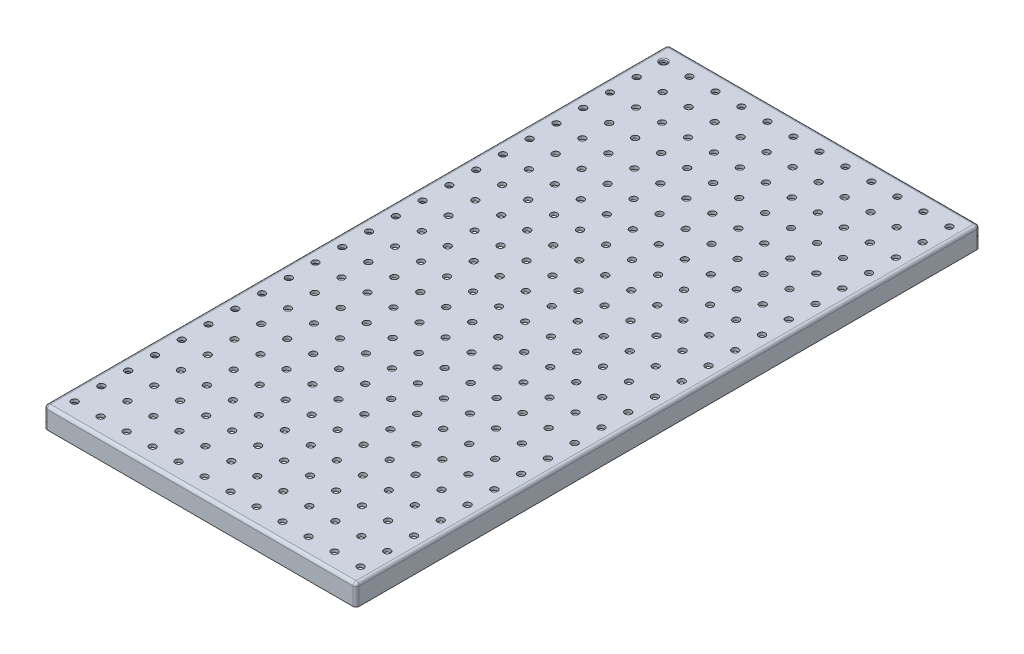
from build123d import *

# Parameters (mm, degrees)
CROQUIS1_W              = 300
CROQUIS1_H              = 600
SALIENTE_EXTRUIR1_DEPTH = 20
VACIADO1_T              = -3
CROQUIS4_R              = 3.175
CORTAR_EXTRUIR1_DEPTH   = 10
REDONDEO1_R             = 3
REDONDEO2_R             = 3
REDONDEO3_R             = 1


with BuildPart() as part:
    # Croquis1 → Saliente-Extruir1 (new body)
    with BuildSketch(Plane(origin=(0, 0, 0), x_dir=(1, 0, 0), z_dir=(0, 1, 0))):
        Rectangle(CROQUIS1_W, CROQUIS1_H)
    extrude(amount=SALIENTE_EXTRUIR1_DEPTH)

    # Vaciado1
    vaciado1_openings = [part.faces().sort_by_distance(p)[0] for p in [
        (0, 0, 0),
    ]]
    offset(amount=VACIADO1_T, openings=vaciado1_openings, kind=Kind.INTERSECTION)

    # Croquis4 → Cortar-Extruir1 (cut)
    with BuildSketch(Plane(origin=(0, 20, 0), x_dir=(1, 0, 0), z_dir=(0, 1, 0))):
        with Locations((-137.5, 283.194458678)):
            Circle(CROQUIS4_R)
        with Locations((-112.5, 283.194458678)):
            Circle(CROQUIS4_R)
        with Locations((-87.5, 283.194458678)):
            Circle(CROQUIS4_R)
        with Locations((-62.5, 283.194458678)):
            Circle(CROQUIS4_R)
        with Locations((-37.5, 283.194458678)):
            Circle(CROQUIS4_R)
        with Locations((-12.5, 283.194458678)):
            Circle(CROQUIS4_R)
        with Locations((12.5, 283.194458678)):
            Circle(CROQUIS4_R)
        with Locations((37.5, 283.194458678)):
            Circle(CROQUIS4_R)
        with Locations((62.5, 283.194458678)):
            Circle(CROQUIS4_R)
        with Locations((87.5, 283.194458678)):
            Circle(CROQUIS4_R)
        with Locations((112.5, 283.194458678)):
            Circle(CROQUIS4_R)
        with Locations((137.5, 283.194458678)):
            Circle(CROQUIS4_R)
        with Locations((-137.5, 257.449507889)):
            Circle(CROQUIS4_R)
        with Locations((-112.5, 257.449507889)):
            Circle(CROQUIS4_R)
        with Locations((-87.5, 257.449507889)):
            Circle(CROQUIS4_R)
        with Locations((-62.5, 257.449507889)):
            Circle(CROQUIS4_R)
        with Locations((-37.5, 257.449507889)):
            Circle(CROQUIS4_R)
        with Locations((-12.5, 257.449507889)):
            Circle(CROQUIS4_R)
        with Locations((12.5, 257.449507889)):
            Circle(CROQUIS4_R)
        with Locations((37.5, 257.449507889)):
            Circle(CROQUIS4_R)
        with Locations((62.5, 257.449507889)):
            Circle(CROQUIS4_R)
        with Locations((87.5, 257.449507889)):
            Circle(CROQUIS4_R)
        with Locations((112.5, 257.449507889)):
            Circle(CROQUIS4_R)
        with Locations((137.5, 257.449507889)):
            Circle(CROQUIS4_R)
        with Locations((-137.5, 231.7045571)):
            Circle(CROQUIS4_R)
        with Locations((-112.5, 231.7045571)):
            Circle(CROQUIS4_R)
        with Locations((-87.5, 231.7045571)):
            Circle(CROQUIS4_R)
        with Locations((-62.5, 231.7045571)):
            Circle(CROQUIS4_R)
        with Locations((-37.5, 231.7045571)):
            Circle(CROQUIS4_R)
        with Locations((-12.5, 231.7045571)):
            Circle(CROQUIS4_R)
        with Locations((12.5, 231.7045571)):
            Circle(CROQUIS4_R)
        with Locations((37.5, 231.7045571)):
            Circle(CROQUIS4_R)
        with Locations((62.5, 231.7045571)):
            Circle(CROQUIS4_R)
        with Locations((87.5, 231.7045571)):
            Circle(CROQUIS4_R)
        with Locations((112.5, 231.7045571)):
            Circle(CROQUIS4_R)
        with Locations((137.5, 231.7045571)):
            Circle(CROQUIS4_R)
        with Locations((-137.5, 205.959606311)):
            Circle(CROQUIS4_R)
        with Locations((-112.5, 205.959606311)):
            Circle(CROQUIS4_R)
        with Locations((-87.5, 205.959606311)):
            Circle(CROQUIS4_R)
        with Locations((-62.5, 205.959606311)):
            Circle(CROQUIS4_R)
        with Locations((-37.5, 205.959606311)):
            Circle(CROQUIS4_R)
        with Locations((-12.5, 205.959606311)):
            Circle(CROQUIS4_R)
        with Locations((12.5, 205.959606311)):
            Circle(CROQUIS4_R)
        with Locations((37.5, 205.959606311)):
            Circle(CROQUIS4_R)
        with Locations((62.5, 205.959606311)):
            Circle(CROQUIS4_R)
        with Locations((87.5, 205.959606311)):
            Circle(CROQUIS4_R)
        with Locations((112.5, 205.959606311)):
            Circle(CROQUIS4_R)
        with Locations((137.5, 205.959606311)):
            Circle(CROQUIS4_R)
        with Locations((-137.5, 180.214655522)):
            Circle(CROQUIS4_R)
        with Locations((-112.5, 180.214655522)):
            Circle(CROQUIS4_R)
        with Locations((-87.5, 180.214655522)):
            Circle(CROQUIS4_R)
        with Locations((-62.5, 180.214655522)):
            Circle(CROQUIS4_R)
        with Locations((-37.5, 180.214655522)):
            Circle(CROQUIS4_R)
        with Locations((-12.5, 180.214655522)):
            Circle(CROQUIS4_R)
        with Locations((12.5, 180.214655522)):
            Circle(CROQUIS4_R)
        with Locations((37.5, 180.214655522)):
            Circle(CROQUIS4_R)
        with Locations((62.5, 180.214655522)):
            Circle(CROQUIS4_R)
        with Locations((87.5, 180.214655522)):
            Circle(CROQUIS4_R)
        with Locations((112.5, 180.214655522)):
            Circle(CROQUIS4_R)
        with Locations((137.5, 180.214655522)):
            Circle(CROQUIS4_R)
        with Locations((-137.5, 154.469704733)):
            Circle(CROQUIS4_R)
        with Locations((-112.5, 154.469704733)):
            Circle(CROQUIS4_R)
        with Locations((-87.5, 154.469704733)):
            Circle(CROQUIS4_R)
        with Locations((-62.5, 154.469704733)):
            Circle(CROQUIS4_R)
        with Locations((-37.5, 154.469704733)):
            Circle(CROQUIS4_R)
        with Locations((-12.5, 154.469704733)):
            Circle(CROQUIS4_R)
        with Locations((12.5, 154.469704733)):
            Circle(CROQUIS4_R)
        with Locations((37.5, 154.469704733)):
            Circle(CROQUIS4_R)
        with Locations((62.5, 154.469704733)):
            Circle(CROQUIS4_R)
        with Locations((87.5, 154.469704733)):
            Circle(CROQUIS4_R)
        with Locations((112.5, 154.469704733)):
            Circle(CROQUIS4_R)
        with Locations((137.5, 154.469704733)):
            Circle(CROQUIS4_R)
        with Locations((-137.5, 128.724753944)):
            Circle(CROQUIS4_R)
        with Locations((-112.5, 128.724753944)):
            Circle(CROQUIS4_R)
        with Locations((-87.5, 128.724753944)):
            Circle(CROQUIS4_R)
        with Locations((-62.5, 128.724753944)):
            Circle(CROQUIS4_R)
        with Locations((-37.5, 128.724753944)):
            Circle(CROQUIS4_R)
        with Locations((-12.5, 128.724753944)):
            Circle(CROQUIS4_R)
        with Locations((12.5, 128.724753944)):
            Circle(CROQUIS4_R)
        with Locations((37.5, 128.724753944)):
            Circle(CROQUIS4_R)
        with Locations((62.5, 128.724753944)):
            Circle(CROQUIS4_R)
        with Locations((87.5, 128.724753944)):
            Circle(CROQUIS4_R)
        with Locations((112.5, 128.724753944)):
            Circle(CROQUIS4_R)
        with Locations((137.5, 128.724753944)):
            Circle(CROQUIS4_R)
        with Locations((-137.5, 102.979803155)):
            Circle(CROQUIS4_R)
        with Locations((-112.5, 102.979803155)):
            Circle(CROQUIS4_R)
        with Locations((-87.5, 102.979803155)):
            Circle(CROQUIS4_R)
        with Locations((-62.5, 102.979803155)):
            Circle(CROQUIS4_R)
        with Locations((-37.5, 102.979803155)):
            Circle(CROQUIS4_R)
        with Locations((-12.5, 102.979803155)):
            Circle(CROQUIS4_R)
        with Locations((12.5, 102.979803155)):
            Circle(CROQUIS4_R)
        with Locations((37.5, 102.979803155)):
            Circle(CROQUIS4_R)
        with Locations((62.5, 102.979803155)):
            Circle(CROQUIS4_R)
        with Locations((87.5, 102.979803155)):
            Circle(CROQUIS4_R)
        with Locations((112.5, 102.979803155)):
            Circle(CROQUIS4_R)
        with Locations((137.5, 102.979803155)):
            Circle(CROQUIS4_R)
        with Locations((-137.5, 77.234852367)):
            Circle(CROQUIS4_R)
        with Locations((-112.5, 77.234852367)):
            Circle(CROQUIS4_R)
        with Locations((-87.5, 77.234852367)):
            Circle(CROQUIS4_R)
        with Locations((-62.5, 77.234852367)):
            Circle(CROQUIS4_R)
        with Locations((-37.5, 77.234852367)):
            Circle(CROQUIS4_R)
        with Locations((-12.5, 77.234852367)):
            Circle(CROQUIS4_R)
        with Locations((12.5, 77.234852367)):
            Circle(CROQUIS4_R)
        with Locations((37.5, 77.234852367)):
            Circle(CROQUIS4_R)
        with Locations((62.5, 77.234852367)):
            Circle(CROQUIS4_R)
        with Locations((87.5, 77.234852367)):
            Circle(CROQUIS4_R)
        with Locations((112.5, 77.234852367)):
            Circle(CROQUIS4_R)
        with Locations((137.5, 77.234852367)):
            Circle(CROQUIS4_R)
        with Locations((-137.5, 51.489901578)):
            Circle(CROQUIS4_R)
        with Locations((-112.5, 51.489901578)):
            Circle(CROQUIS4_R)
        with Locations((-87.5, 51.489901578)):
            Circle(CROQUIS4_R)
        with Locations((-62.5, 51.489901578)):
            Circle(CROQUIS4_R)
        with Locations((-37.5, 51.489901578)):
            Circle(CROQUIS4_R)
        with Locations((-12.5, 51.489901578)):
            Circle(CROQUIS4_R)
        with Locations((12.5, 51.489901578)):
            Circle(CROQUIS4_R)
        with Locations((37.5, 51.489901578)):
            Circle(CROQUIS4_R)
        with Locations((62.5, 51.489901578)):
            Circle(CROQUIS4_R)
        with Locations((87.5, 51.489901578)):
            Circle(CROQUIS4_R)
        with Locations((112.5, 51.489901578)):
            Circle(CROQUIS4_R)
        with Locations((137.5, 51.489901578)):
            Circle(CROQUIS4_R)
        with Locations((-137.5, 25.744950789)):
            Circle(CROQUIS4_R)
        with Locations((-112.5, 25.744950789)):
            Circle(CROQUIS4_R)
        with Locations((-87.5, 25.744950789)):
            Circle(CROQUIS4_R)
        with Locations((-62.5, 25.744950789)):
            Circle(CROQUIS4_R)
        with Locations((-37.5, 25.744950789)):
            Circle(CROQUIS4_R)
        with Locations((-12.5, 25.744950789)):
            Circle(CROQUIS4_R)
        with Locations((12.5, 25.744950789)):
            Circle(CROQUIS4_R)
        with Locations((37.5, 25.744950789)):
            Circle(CROQUIS4_R)
        with Locations((62.5, 25.744950789)):
            Circle(CROQUIS4_R)
        with Locations((87.5, 25.744950789)):
            Circle(CROQUIS4_R)
        with Locations((112.5, 25.744950789)):
            Circle(CROQUIS4_R)
        with Locations((137.5, 25.744950789)):
            Circle(CROQUIS4_R)
        with Locations((-137.5, 0)):
            Circle(CROQUIS4_R)
        with Locations((-112.5, 0)):
            Circle(CROQUIS4_R)
        with Locations((-87.5, 0)):
            Circle(CROQUIS4_R)
        with Locations((-62.5, 0)):
            Circle(CROQUIS4_R)
        with Locations((-37.5, 0)):
            Circle(CROQUIS4_R)
        with Locations((-12.5, 0)):
            Circle(CROQUIS4_R)
        with Locations((12.5, 0)):
            Circle(CROQUIS4_R)
        with Locations((37.5, 0)):
            Circle(CROQUIS4_R)
        with Locations((62.5, 0)):
            Circle(CROQUIS4_R)
        with Locations((87.5, 0)):
            Circle(CROQUIS4_R)
        with Locations((112.5, 0)):
            Circle(CROQUIS4_R)
        with Locations((137.5, 0)):
            Circle(CROQUIS4_R)
        with Locations((-137.5, -25.744950789)):
            Circle(CROQUIS4_R)
        with Locations((-112.5, -25.744950789)):
            Circle(CROQUIS4_R)
        with Locations((-87.5, -25.744950789)):
            Circle(CROQUIS4_R)
        with Locations((-62.5, -25.744950789)):
            Circle(CROQUIS4_R)
        with Locations((-37.5, -25.744950789)):
            Circle(CROQUIS4_R)
        with Locations((-12.5, -25.744950789)):
            Circle(CROQUIS4_R)
        with Locations((12.5, -25.744950789)):
            Circle(CROQUIS4_R)
        with Locations((37.5, -25.744950789)):
            Circle(CROQUIS4_R)
        with Locations((62.5, -25.744950789)):
            Circle(CROQUIS4_R)
        with Locations((87.5, -25.744950789)):
            Circle(CROQUIS4_R)
        with Locations((112.5, -25.744950789)):
            Circle(CROQUIS4_R)
        with Locations((137.5, -25.744950789)):
            Circle(CROQUIS4_R)
        with Locations((-137.5, -51.489901578)):
            Circle(CROQUIS4_R)
        with Locations((-112.5, -51.489901578)):
            Circle(CROQUIS4_R)
        with Locations((-87.5, -51.489901578)):
            Circle(CROQUIS4_R)
        with Locations((-62.5, -51.489901578)):
            Circle(CROQUIS4_R)
        with Locations((-37.5, -51.489901578)):
            Circle(CROQUIS4_R)
        with Locations((-12.5, -51.489901578)):
            Circle(CROQUIS4_R)
        with Locations((12.5, -51.489901578)):
            Circle(CROQUIS4_R)
        with Locations((37.5, -51.489901578)):
            Circle(CROQUIS4_R)
        with Locations((62.5, -51.489901578)):
            Circle(CROQUIS4_R)
        with Locations((87.5, -51.489901578)):
            Circle(CROQUIS4_R)
        with Locations((112.5, -51.489901578)):
            Circle(CROQUIS4_R)
        with Locations((137.5, -51.489901578)):
            Circle(CROQUIS4_R)
        with Locations((-137.5, -77.234852367)):
            Circle(CROQUIS4_R)
        with Locations((-112.5, -77.234852367)):
            Circle(CROQUIS4_R)
        with Locations((-87.5, -77.234852367)):
            Circle(CROQUIS4_R)
        with Locations((-62.5, -77.234852367)):
            Circle(CROQUIS4_R)
        with Locations((-37.5, -77.234852367)):
            Circle(CROQUIS4_R)
        with Locations((-12.5, -77.234852367)):
            Circle(CROQUIS4_R)
        with Locations((12.5, -77.234852367)):
            Circle(CROQUIS4_R)
        with Locations((37.5, -77.234852367)):
            Circle(CROQUIS4_R)
        with Locations((62.5, -77.234852367)):
            Circle(CROQUIS4_R)
        with Locations((87.5, -77.234852367)):
            Circle(CROQUIS4_R)
        with Locations((112.5, -77.234852367)):
            Circle(CROQUIS4_R)
        with Locations((137.5, -77.234852367)):
            Circle(CROQUIS4_R)
        with Locations((-137.5, -102.979803155)):
            Circle(CROQUIS4_R)
        with Locations((-112.5, -102.979803155)):
            Circle(CROQUIS4_R)
        with Locations((-87.5, -102.979803155)):
            Circle(CROQUIS4_R)
        with Locations((-62.5, -102.979803155)):
            Circle(CROQUIS4_R)
        with Locations((-37.5, -102.979803155)):
            Circle(CROQUIS4_R)
        with Locations((-12.5, -102.979803155)):
            Circle(CROQUIS4_R)
        with Locations((12.5, -102.979803155)):
            Circle(CROQUIS4_R)
        with Locations((37.5, -102.979803155)):
            Circle(CROQUIS4_R)
        with Locations((62.5, -102.979803155)):
            Circle(CROQUIS4_R)
        with Locations((87.5, -102.979803155)):
            Circle(CROQUIS4_R)
        with Locations((112.5, -102.979803155)):
            Circle(CROQUIS4_R)
        with Locations((137.5, -102.979803155)):
            Circle(CROQUIS4_R)
        with Locations((-137.5, -128.724753944)):
            Circle(CROQUIS4_R)
        with Locations((-112.5, -128.724753944)):
            Circle(CROQUIS4_R)
        with Locations((-87.5, -128.724753944)):
            Circle(CROQUIS4_R)
        with Locations((-62.5, -128.724753944)):
            Circle(CROQUIS4_R)
        with Locations((-37.5, -128.724753944)):
            Circle(CROQUIS4_R)
        with Locations((-12.5, -128.724753944)):
            Circle(CROQUIS4_R)
        with Locations((12.5, -128.724753944)):
            Circle(CROQUIS4_R)
        with Locations((37.5, -128.724753944)):
            Circle(CROQUIS4_R)
        with Locations((62.5, -128.724753944)):
            Circle(CROQUIS4_R)
        with Locations((87.5, -128.724753944)):
            Circle(CROQUIS4_R)
        with Locations((112.5, -128.724753944)):
            Circle(CROQUIS4_R)
        with Locations((137.5, -128.724753944)):
            Circle(CROQUIS4_R)
        with Locations((-137.5, -154.469704733)):
            Circle(CROQUIS4_R)
        with Locations((-112.5, -154.469704733)):
            Circle(CROQUIS4_R)
        with Locations((-87.5, -154.469704733)):
            Circle(CROQUIS4_R)
        with Locations((-62.5, -154.469704733)):
            Circle(CROQUIS4_R)
        with Locations((-37.5, -154.469704733)):
            Circle(CROQUIS4_R)
        with Locations((-12.5, -154.469704733)):
            Circle(CROQUIS4_R)
        with Locations((12.5, -154.469704733)):
            Circle(CROQUIS4_R)
        with Locations((37.5, -154.469704733)):
            Circle(CROQUIS4_R)
        with Locations((62.5, -154.469704733)):
            Circle(CROQUIS4_R)
        with Locations((87.5, -154.469704733)):
            Circle(CROQUIS4_R)
        with Locations((112.5, -154.469704733)):
            Circle(CROQUIS4_R)
        with Locations((137.5, -154.469704733)):
            Circle(CROQUIS4_R)
        with Locations((-137.5, -180.214655522)):
            Circle(CROQUIS4_R)
        with Locations((-112.5, -180.214655522)):
            Circle(CROQUIS4_R)
        with Locations((-87.5, -180.214655522)):
            Circle(CROQUIS4_R)
        with Locations((-62.5, -180.214655522)):
            Circle(CROQUIS4_R)
        with Locations((-37.5, -180.214655522)):
            Circle(CROQUIS4_R)
        with Locations((-12.5, -180.214655522)):
            Circle(CROQUIS4_R)
        with Locations((12.5, -180.214655522)):
            Circle(CROQUIS4_R)
        with Locations((37.5, -180.214655522)):
            Circle(CROQUIS4_R)
        with Locations((62.5, -180.214655522)):
            Circle(CROQUIS4_R)
        with Locations((87.5, -180.214655522)):
            Circle(CROQUIS4_R)
        with Locations((112.5, -180.214655522)):
            Circle(CROQUIS4_R)
        with Locations((137.5, -180.214655522)):
            Circle(CROQUIS4_R)
        with Locations((-137.5, -205.959606311)):
            Circle(CROQUIS4_R)
        with Locations((-112.5, -205.959606311)):
            Circle(CROQUIS4_R)
        with Locations((-87.5, -205.959606311)):
            Circle(CROQUIS4_R)
        with Locations((-62.5, -205.959606311)):
            Circle(CROQUIS4_R)
        with Locations((-37.5, -205.959606311)):
            Circle(CROQUIS4_R)
        with Locations((-12.5, -205.959606311)):
            Circle(CROQUIS4_R)
        with Locations((12.5, -205.959606311)):
            Circle(CROQUIS4_R)
        with Locations((37.5, -205.959606311)):
            Circle(CROQUIS4_R)
        with Locations((62.5, -205.959606311)):
            Circle(CROQUIS4_R)
        with Locations((87.5, -205.959606311)):
            Circle(CROQUIS4_R)
        with Locations((112.5, -205.959606311)):
            Circle(CROQUIS4_R)
        with Locations((137.5, -205.959606311)):
            Circle(CROQUIS4_R)
        with Locations((-137.5, -231.7045571)):
            Circle(CROQUIS4_R)
        with Locations((-112.5, -231.7045571)):
            Circle(CROQUIS4_R)
        with Locations((-87.5, -231.7045571)):
            Circle(CROQUIS4_R)
        with Locations((-62.5, -231.7045571)):
            Circle(CROQUIS4_R)
        with Locations((-37.5, -231.7045571)):
            Circle(CROQUIS4_R)
        with Locations((-12.5, -231.7045571)):
            Circle(CROQUIS4_R)
        with Locations((12.5, -231.7045571)):
            Circle(CROQUIS4_R)
        with Locations((37.5, -231.7045571)):
            Circle(CROQUIS4_R)
        with Locations((62.5, -231.7045571)):
            Circle(CROQUIS4_R)
        with Locations((87.5, -231.7045571)):
            Circle(CROQUIS4_R)
        with Locations((112.5, -231.7045571)):
            Circle(CROQUIS4_R)
        with Locations((137.5, -231.7045571)):
            Circle(CROQUIS4_R)
        with Locations((-137.5, -257.449507889)):
            Circle(CROQUIS4_R)
        with Locations((-112.5, -257.449507889)):
            Circle(CROQUIS4_R)
        with Locations((-87.5, -257.449507889)):
            Circle(CROQUIS4_R)
        with Locations((-62.5, -257.449507889)):
            Circle(CROQUIS4_R)
        with Locations((-37.5, -257.449507889)):
            Circle(CROQUIS4_R)
        with Locations((-12.5, -257.449507889)):
            Circle(CROQUIS4_R)
        with Locations((12.5, -257.449507889)):
            Circle(CROQUIS4_R)
        with Locations((37.5, -257.449507889)):
            Circle(CROQUIS4_R)
        with Locations((62.5, -257.449507889)):
            Circle(CROQUIS4_R)
        with Locations((87.5, -257.449507889)):
            Circle(CROQUIS4_R)
        with Locations((112.5, -257.449507889)):
            Circle(CROQUIS4_R)
        with Locations((137.5, -257.449507889)):
            Circle(CROQUIS4_R)
        with Locations((-137.5, -283.194458678)):
            Circle(CROQUIS4_R)
        with Locations((-112.5, -283.194458678)):
            Circle(CROQUIS4_R)
        with Locations((-87.5, -283.194458678)):
            Circle(CROQUIS4_R)
        with Locations((-62.5, -283.194458678)):
            Circle(CROQUIS4_R)
        with Locations((-37.5, -283.194458678)):
            Circle(CROQUIS4_R)
        with Locations((-12.5, -283.194458678)):
            Circle(CROQUIS4_R)
        with Locations((12.5, -283.194458678)):
            Circle(CROQUIS4_R)
        with Locations((37.5, -283.194458678)):
            Circle(CROQUIS4_R)
        with Locations((62.5, -283.194458678)):
            Circle(CROQUIS4_R)
        with Locations((87.5, -283.194458678)):
            Circle(CROQUIS4_R)
        with Locations((112.5, -283.194458678)):
            Circle(CROQUIS4_R)
        with Locations((137.5, -283.194458678)):
            Circle(CROQUIS4_R)
    extrude(amount=-CORTAR_EXTRUIR1_DEPTH, mode=Mode.SUBTRACT)

    # Redondeo1
    redondeo1_edges = [part.edges().sort_by_distance(p)[0] for p in [
        (150, 10, 300),
        (-150, 10, 300),
        (150, 10, -300),
        (-150, 10, -300),
    ]]
    fillet(redondeo1_edges, radius=REDONDEO1_R)

    # Redondeo2
    redondeo2_edges = [part.edges().sort_by_distance(p)[0] for p in [
        (149.121320344, 20, -299.121320344),
        (150, 20, 0),
        (149.121320344, 20, 299.121320344),
        (0, 20, 300),
        (-149.121320344, 20, 299.121320344),
        (-150, 20, 0),
        (-149.121320344, 20, -299.121320344),
        (0, 20, -300),
    ]]
    fillet(redondeo2_edges, radius=REDONDEO2_R)

    # Redondeo3
    redondeo3_edges = [part.edges().sort_by_distance(p)[0] for p in [
        (-140.675, 20, -283.194458678),
    ]]
    fillet(redondeo3_edges, radius=REDONDEO3_R)


solid = part.part
